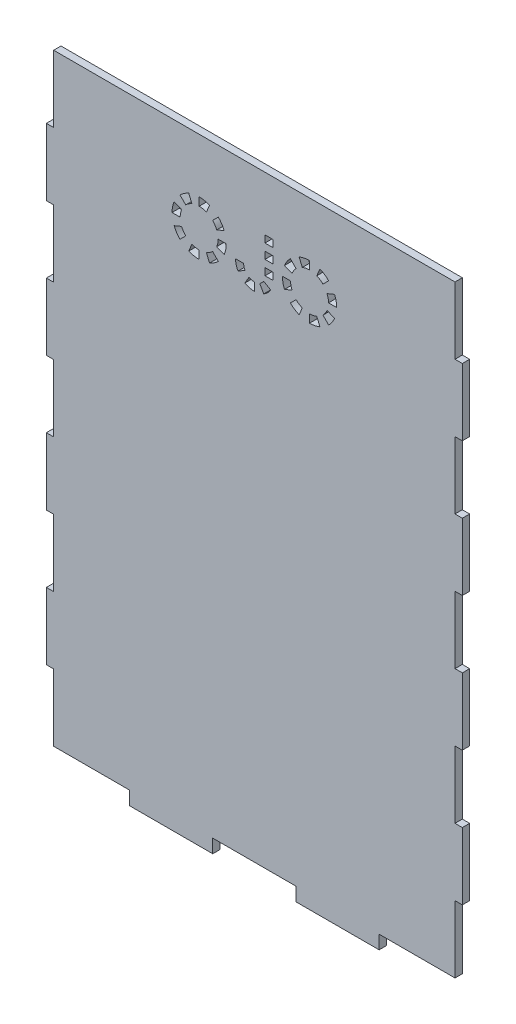
from build123d import *

# Parameters (mm, degrees)
BOSS_EXTRUDE2_DEPTH = 2.7


with BuildPart() as part:
    # Sketch1 → Boss-Extrude2 (new body)
    with BuildSketch(Plane.XY):
        Polygon((46.02, -108.65), (74, -108.65), (74, -83.95), (76.7, -83.95), (76.7, -59.25), (74, -59.25), (74, -34.55), (76.7, -34.55), (76.7, -9.85), (74, -9.85), (74, 14.85), (76.7, 14.85), (76.7, 39.55), (74, 39.55), (74, 64.25), (76.7, 64.25), (76.7, 88.95), (74, 88.95), (74, 113.65), (-74, 113.65), (-74, 88.95), (-76.7, 88.95), (-76.7, 64.25), (-74, 64.25), (-74, 39.55), (-76.7, 39.55), (-76.7, 14.85), (-74, 14.85), (-74, -9.85), (-76.7, -9.85), (-76.7, -34.55), (-74, -34.55), (-74, -59.25), (-76.7, -59.25), (-76.7, -61.75), (-76.7, -83.95), (-74, -83.95), (-74, -108.65), (-46.02, -108.65), (-46.02, -113.65), (-15.34, -113.65), (-15.34, -108.65), (15.34, -108.65), (15.34, -113.65), (46.02, -113.65), align=None)
        with BuildLine():
            Line((-13.280766207, 76.578932188), (-15.402086551, 78.700252532))
            ThreePointArc((-15.402086551, 78.700252532), (-16.462842388, 77.829712714), (-17.673049993, 77.182843272))
            Line((-17.673049993, 77.182843272), (-16.524999695, 74.411204675))
            ThreePointArc((-16.524999695, 74.411204675), (-14.796131689, 75.335303877), (-13.280766207, 76.578932188))
        make_face(mode=Mode.SUBTRACT)
        with BuildLine():
            Line((-11.113038694, 79.823165676), (-13.884677292, 80.971215973))
            ThreePointArc((-13.884677292, 80.971215973), (-13.486337056, 82.284367746), (-13.351834019, 83.65))
            Line((-13.351834019, 83.65), (-10.351834019, 83.65))
            ThreePointArc((-10.351834019, 83.65), (-10.543981215, 81.69909678), (-11.113038694, 79.823165676))
        make_face(mode=Mode.SUBTRACT)
        with BuildLine():
            Line((-11.113038694, 87.476834324), (-13.884677292, 86.328784027))
            ThreePointArc((-13.884677292, 86.328784027), (-14.531546733, 87.538991631), (-15.402086551, 88.599747468))
            Line((-15.402086551, 88.599747468), (-13.280766207, 90.721067812))
            ThreePointArc((-13.280766207, 90.721067812), (-12.037137896, 89.20570233), (-11.113038694, 87.476834324))
        make_face(mode=Mode.SUBTRACT)
        with BuildLine():
            Line((-16.524999695, 92.888795325), (-17.673049993, 90.117156728))
            ThreePointArc((-17.673049993, 90.117156728), (-18.986201765, 90.515496963), (-20.351834019, 90.65))
            Line((-20.351834019, 90.65), (-20.351834019, 93.65))
            ThreePointArc((-20.351834019, 93.65), (-18.400930799, 93.457852804), (-16.524999695, 92.888795325))
        make_face(mode=Mode.SUBTRACT)
        with BuildLine():
            Line((-23.030618046, 90.117156728), (-24.178668343, 92.888795325))
            ThreePointArc((-24.178668343, 92.888795325), (-25.907536349, 91.964696123), (-27.422901831, 90.721067812))
            Line((-27.422901831, 90.721067812), (-25.301581487, 88.599747468))
            ThreePointArc((-25.301581487, 88.599747468), (-24.24082565, 89.470287286), (-23.030618046, 90.117156728))
        make_face(mode=Mode.SUBTRACT)
        with BuildLine():
            Line((-26.818990747, 86.328784027), (-29.590629344, 87.476834324))
            ThreePointArc((-29.590629344, 87.476834324), (-30.159686823, 85.60090322), (-30.351834019, 83.65))
            Line((-30.351834019, 83.65), (-27.351834019, 83.65))
            ThreePointArc((-27.351834019, 83.65), (-27.217330982, 85.015632254), (-26.818990747, 86.328784027))
        make_face(mode=Mode.SUBTRACT)
        with BuildLine():
            Line((-26.818990747, 80.971215973), (-29.590629344, 79.823165676))
            ThreePointArc((-29.590629344, 79.823165676), (-28.666530142, 78.09429767), (-27.422901831, 76.578932188))
            Line((-27.422901831, 76.578932188), (-25.301581487, 78.700252532))
            ThreePointArc((-25.301581487, 78.700252532), (-26.172121305, 79.761008369), (-26.818990747, 80.971215973))
        make_face(mode=Mode.SUBTRACT)
        with BuildLine():
            Line((-23.030618046, 77.182843272), (-24.178668343, 74.411204675))
            ThreePointArc((-24.178668343, 74.411204675), (-22.302737239, 73.842147196), (-20.351834019, 73.65))
            Line((-20.351834019, 73.65), (-20.351834019, 76.65))
            ThreePointArc((-20.351834019, 76.65), (-21.717466273, 76.784503037), (-23.030618046, 77.182843272))
        make_face(mode=Mode.SUBTRACT)
        with BuildLine():
            Line((23.030618046, 77.182843272), (24.178668343, 74.411204675))
            ThreePointArc((24.178668343, 74.411204675), (22.302737239, 73.842147196), (20.351834019, 73.65))
            Line((20.351834019, 73.65), (20.351834019, 76.65))
            ThreePointArc((20.351834019, 76.65), (21.717466273, 76.784503037), (23.030618046, 77.182843272))
        make_face(mode=Mode.SUBTRACT)
        with BuildLine():
            Line((26.818990747, 80.971215973), (29.590629344, 79.823165676))
            ThreePointArc((29.590629344, 79.823165676), (28.666530142, 78.09429767), (27.422901831, 76.578932188))
            Line((27.422901831, 76.578932188), (25.301581487, 78.700252532))
            ThreePointArc((25.301581487, 78.700252532), (26.172121305, 79.761008369), (26.818990747, 80.971215973))
        make_face(mode=Mode.SUBTRACT)
        with BuildLine():
            Line((26.818990747, 86.328784027), (29.590629344, 87.476834324))
            ThreePointArc((29.590629344, 87.476834324), (30.159686823, 85.60090322), (30.351834019, 83.65))
            Line((30.351834019, 83.65), (27.351834019, 83.65))
            ThreePointArc((27.351834019, 83.65), (27.217330982, 85.015632254), (26.818990747, 86.328784027))
        make_face(mode=Mode.SUBTRACT)
        with BuildLine():
            Line((23.030618046, 90.117156728), (24.178668343, 92.888795325))
            ThreePointArc((24.178668343, 92.888795325), (25.907536349, 91.964696123), (27.422901831, 90.721067812))
            Line((27.422901831, 90.721067812), (25.301581487, 88.599747468))
            ThreePointArc((25.301581487, 88.599747468), (24.24082565, 89.470287286), (23.030618046, 90.117156728))
        make_face(mode=Mode.SUBTRACT)
        with BuildLine():
            Line((16.524999695, 92.888795325), (17.673049993, 90.117156728))
            ThreePointArc((17.673049993, 90.117156728), (18.986201765, 90.515496963), (20.351834019, 90.65))
            Line((20.351834019, 90.65), (20.351834019, 93.65))
            ThreePointArc((20.351834019, 93.65), (18.400930799, 93.457852804), (16.524999695, 92.888795325))
        make_face(mode=Mode.SUBTRACT)
        with BuildLine():
            Line((11.113038694, 87.476834324), (13.884677292, 86.328784027))
            ThreePointArc((13.884677292, 86.328784027), (14.531546733, 87.538991631), (15.402086551, 88.599747468))
            Line((15.402086551, 88.599747468), (13.280766207, 90.721067812))
            ThreePointArc((13.280766207, 90.721067812), (12.037137896, 89.20570233), (11.113038694, 87.476834324))
        make_face(mode=Mode.SUBTRACT)
        with BuildLine():
            Line((11.113038694, 79.823165676), (13.884677292, 80.971215973))
            ThreePointArc((13.884677292, 80.971215973), (13.486337056, 82.284367746), (13.351834019, 83.65))
            Line((13.351834019, 83.65), (10.351834019, 83.65))
            ThreePointArc((10.351834019, 83.65), (10.543981215, 81.69909678), (11.113038694, 79.823165676))
        make_face(mode=Mode.SUBTRACT)
        with BuildLine():
            Line((13.280766207, 76.578932188), (15.402086551, 78.700252532))
            ThreePointArc((15.402086551, 78.700252532), (16.462842388, 77.829712714), (17.673049993, 77.182843272))
            Line((17.673049993, 77.182843272), (16.524999695, 74.411204675))
            ThreePointArc((16.524999695, 74.411204675), (14.796131689, 75.335303877), (13.280766207, 76.578932188))
        make_face(mode=Mode.SUBTRACT)
        with BuildLine():
            Line((-6.942099487, 80.593058748), (-3.939040672, 80.593058748))
            ThreePointArc((-3.939040672, 80.593058748), (-3.804788428, 79.573311711), (-3.411180763, 78.623058748))
            Line((-3.411180763, 78.623058748), (-6.011905985, 77.121529341))
            ThreePointArc((-6.011905985, 77.121529341), (-6.705520494, 78.796062896), (-6.942099487, 80.593058748))
        make_face(mode=Mode.SUBTRACT)
        Polygon((6.944018143, 93.65), (3.930401386, 93.65), (3.932512974, 91.03861175), (6.944018143, 91.03861175), align=None, mode=Mode.SUBTRACT)
        Polygon((3.940959328, 80.593058748), (3.93884774, 83.204446999), (6.944018143, 83.204446999), (6.944018143, 80.593058748), align=None, mode=Mode.SUBTRACT)
        Polygon((3.936736151, 85.815835249), (3.934624563, 88.427223499), (6.944018143, 88.427223499), (6.944018143, 85.815835249), align=None, mode=Mode.SUBTRACT)
        with BuildLine():
            Line((-3.470570079, 74.580193435), (-1.969040672, 77.180918657))
            ThreePointArc((-1.969040672, 77.180918657), (-1.01878771, 76.787310993), (0.000959328, 76.653058748))
            Line((0.000959328, 76.653058748), (0.000959328, 73.649999934))
            ThreePointArc((0.000959328, 73.649999934), (-1.796036524, 73.886578926), (-3.470570079, 74.580193435))
        make_face(mode=Mode.SUBTRACT)
        with BuildLine():
            Line((3.472488735, 74.580193435), (1.970959328, 77.180918657))
            ThreePointArc((1.970959328, 77.180918657), (2.786960046, 77.80705803), (3.413099419, 78.623058748))
            Line((3.413099419, 78.623058748), (6.013824641, 77.121529341))
            ThreePointArc((6.013824641, 77.121529341), (4.910443298, 75.683574778), (3.472488735, 74.580193435))
        make_face(mode=Mode.SUBTRACT)
    extrude(amount=BOSS_EXTRUDE2_DEPTH)


solid = part.part
